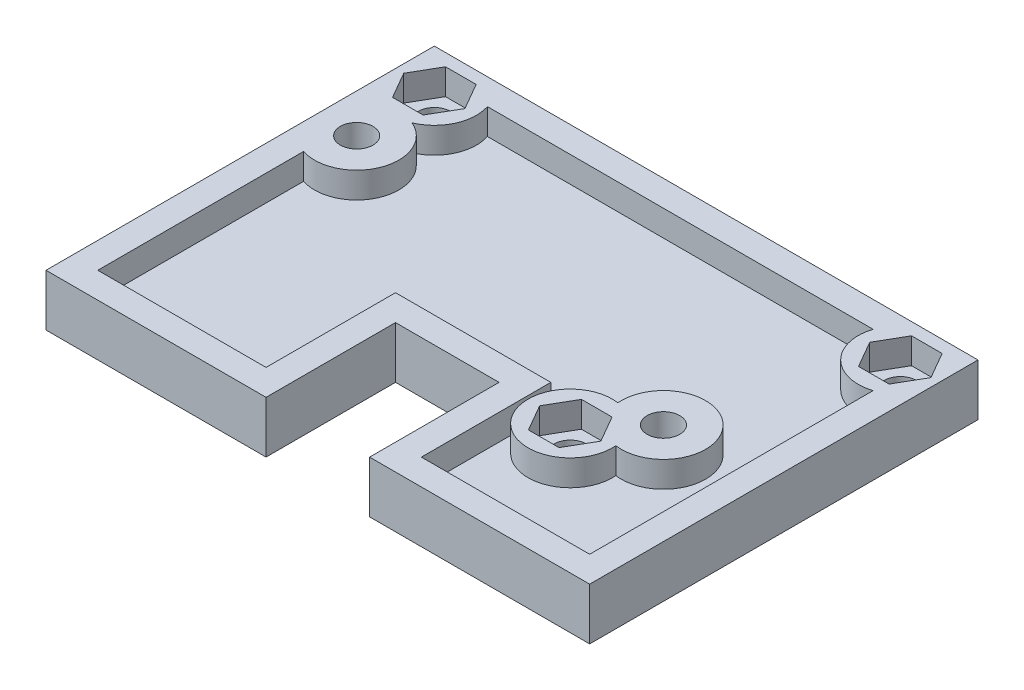
from build123d import *

# Parameters (mm, degrees)
SKETCH1_R           = 1.6
BOSS_EXTRUDE1_DEPTH = 5.08
SHELL1_START        = 2.54
SHELL1_DEPTH        = 2.54
CUT_EXTRUDE1_DEPTH  = 2.54


# Read off the part's stored shape, not the designer's step: Shell1
with BuildPart() as part:
    # Sketch1 → Boss-Extrude1 (new body)
    with BuildSketch(Plane(origin=(0, 0, 0), x_dir=(1, 0, 0), z_dir=(0, 1, 0))):
        Polygon((-5.08, -6.35), (5.08, -6.35), (5.08, -19.05), (26.67, -19.05), (26.67, 19.05), (-26.67, 19.05), (-26.67, -19.05), (-5.08, -19.05), align=None)
        with Locations(Location((12.065, -6.35, 0), (0, 0, 270))):
            Circle(SKETCH1_R, mode=Mode.SUBTRACT)
        with Locations(Location((-22.86, 15.24, 0), (0, 0, 270))):
            Circle(SKETCH1_R, mode=Mode.SUBTRACT)
        with Locations(Location((16.764, -1.905, 0), (0, 0, 270))):
            Circle(SKETCH1_R, mode=Mode.SUBTRACT)
        with Locations(Location((-22.86, 7.62, 0), (0, 0, 270))):
            Circle(SKETCH1_R, mode=Mode.SUBTRACT)
        with Locations(Location((22.86, 15.24, 0), (0, 0, 270))):
            Circle(SKETCH1_R, mode=Mode.SUBTRACT)
    extrude(amount=BOSS_EXTRUDE1_DEPTH)

    # Shell1 outline → Shell1 (cut)
    with BuildSketch(Plane(origin=(0, 0, 0), x_dir=(1, 0, 0), z_dir=(0, 1, 0)).offset(SHELL1_START)):
        with BuildLine():
            Line((-7.62, -16.51), (-7.62, -3.81))
            Line((-7.62, -3.81), (7.62, -3.81))
            Line((7.62, -3.81), (7.62, -16.51))
            Line((7.62, -16.51), (24.13, -16.51))
            Line((24.13, -16.51), (24.13, 11.299606619))
            ThreePointArc((24.13, 11.299606619), (19.932577926, 12.312577926), (18.919606619, 16.51))
            Line((18.919606619, 16.51), (-18.919606619, 16.51))
            ThreePointArc((-18.919606619, 16.51), (-19.094323259, 13.519744587), (-21.240277802, 11.43))
            ThreePointArc((-21.240277802, 11.43), (-18.980860173, 6.173668709), (-24.13, 3.679606619))
            Line((-24.13, 3.679606619), (-24.13, -16.51))
            Line((-24.13, -16.51), (-7.62, -16.51))
        make_face()
        with BuildLine():
            ThreePointArc((12.638391662, -2.249899757), (19.771579246, 0.940007395), (16.190608338, -6.005100243))
            ThreePointArc((16.190608338, -6.005100243), (9.057420754, -9.195007395), (12.638391662, -2.249899757))
        make_face(mode=Mode.SUBTRACT)
    extrude(amount=SHELL1_DEPTH, mode=Mode.SUBTRACT)

    # Sketch8 → Cut-Extrude1 (cut)
    with BuildSketch(Plane(origin=(0, 5.08, 0), x_dir=(1, 0, 0), z_dir=(0, 1, 0))):
        Polygon((-19.8577786, 15.24), (-21.3588893, 17.84), (-24.3611107, 17.84), (-25.8622214, 15.24), (-24.3611107, 12.64), (-21.3588893, 12.64), align=None)
        Polygon((25.8622214, 15.24), (24.3611107, 17.84), (21.3588893, 17.84), (19.8577786, 15.24), (21.3588893, 12.64), (24.3611107, 12.64), align=None)
        Polygon((15.0672214, -6.35), (13.5661107, -3.75), (10.5638893, -3.75), (9.0627786, -6.35), (10.5638893, -8.95), (13.5661107, -8.95), align=None)
    extrude(amount=-CUT_EXTRUDE1_DEPTH, mode=Mode.SUBTRACT)


solid = part.part
